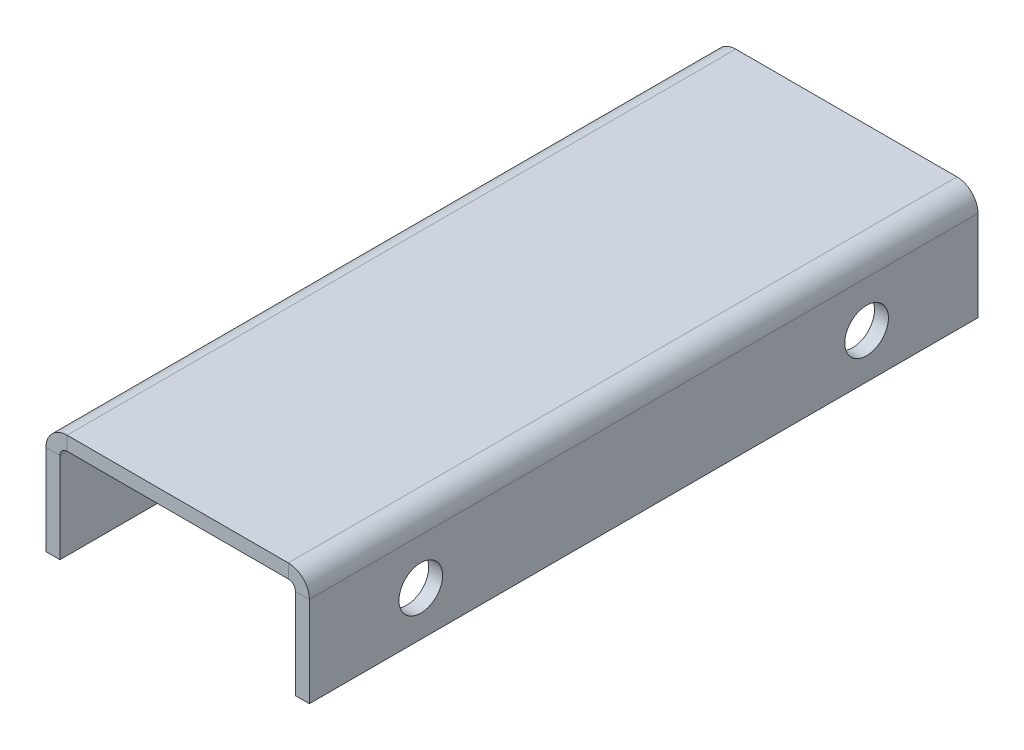
from build123d import *

# Parameters (mm, degrees)
BASE_FLANGE1_DEPTH = 76.2
SKETCH2_R          = 2.4892
CUT_EXTRUDE1_DEPTH = 83.876344995


# Sheet-metal steps are written as plain solids
with BuildPart() as part:
    # Sketch1 → Base-Flange1 (new body)
    with BuildSketch(Plane.XY):
        with BuildLine():
            Line((-15.00632, -12.7), (-15.00632, -2.4003))
            ThreePointArc((-15.00632, -2.4003), (-14.303288407, -0.703031593), (-12.60602, 0))
            Line((-12.60602, 0), (12.60602, 0))
            ThreePointArc((12.60602, 0), (14.303288407, -0.703031593), (15.00632, -2.4003))
            Line((15.00632, -2.4003), (15.00632, -12.7))
            Line((15.00632, -12.7), (13.41882, -12.7))
            Line((13.41882, -12.7), (13.41882, -2.4003))
            ThreePointArc((13.41882, -2.4003), (13.180756392, -1.825563608), (12.60602, -1.5875))
            Line((12.60602, -1.5875), (-12.60602, -1.5875))
            ThreePointArc((-12.60602, -1.5875), (-13.180756392, -1.825563608), (-13.41882, -2.4003))
            Line((-13.41882, -2.4003), (-13.41882, -12.7))
            Line((-13.41882, -12.7), (-15.00632, -12.7))
        make_face()
    extrude(amount=BASE_FLANGE1_DEPTH)

    # Sketch2 → Cut-Extrude1 (cut, through all)
    with BuildSketch(Plane(origin=(15.00632, 0, 0), x_dir=(0, 0, -1), z_dir=(1, 0, 0))):
        with Locations((-63.5, -7.62)):
            Circle(SKETCH2_R)
        with Locations((-12.7, -7.62)):
            Circle(SKETCH2_R)
    extrude(amount=-CUT_EXTRUDE1_DEPTH, mode=Mode.SUBTRACT)


solid = part.part
